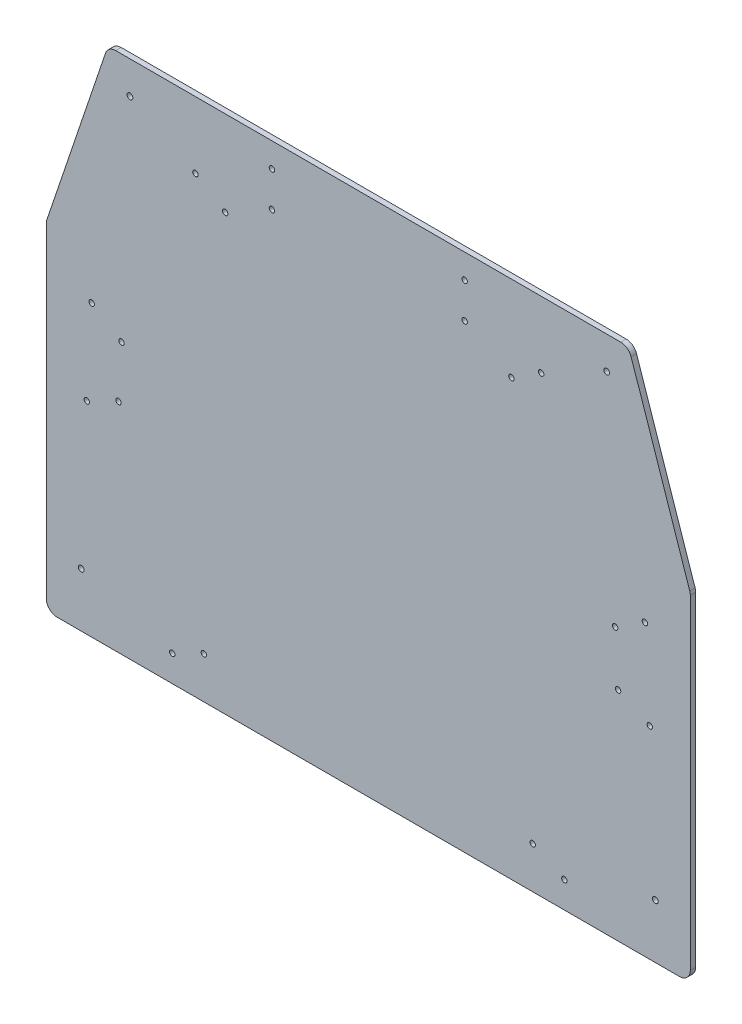
from build123d import *

# Parameters (mm, degrees)
SKETCH1_R                             = 5.3578125
BOSS_EXTRUDE1_DEPTH                   = 6.35
FILLET1_R                             = 6.35
CUT_EXTRUDE1_DEPTH                    = 1167.284548985
BOSS_EXTRUDE3_DEPTH                   = 6.35
SKETCH13_W                            = 3.175
SKETCH13_H                            = 76.2
F_1_4_0_25_DIAMETER_HOLE4_AT_2_COUNT  = 2
F_1_4_0_25_DIAMETER_HOLE4_AT_2_PITCH  = 459.678567638
F_1_4_0_25_DIAMETER_HOLE4_AT_3_COUNT  = 2
F_1_4_0_25_DIAMETER_HOLE4_AT_3_PITCH  = 596.539198556
F_1_4_0_25_DIAMETER_HOLE4_AT_4_COUNT  = 2
F_1_4_0_25_DIAMETER_HOLE4_AT_4_PITCH  = 568.707381741
F_1_4_0_25_DIAMETER_HOLE4_AT_5_COUNT  = 2
F_1_4_0_25_DIAMETER_HOLE4_AT_5_PITCH  = 422.93434027
F_1_4_0_25_DIAMETER_HOLE4_AT_6_COUNT  = 2
F_1_4_0_25_DIAMETER_HOLE4_AT_6_PITCH  = 592.904725038
F_1_4_0_25_DIAMETER_HOLE4_AT_7_COUNT  = 2
F_1_4_0_25_DIAMETER_HOLE4_AT_7_PITCH  = 634.11103449
F_1_4_0_25_DIAMETER_HOLE4_AT_8_COUNT  = 2
F_1_4_0_25_DIAMETER_HOLE4_AT_8_PITCH  = 622.278043561
F_1_4_0_25_DIAMETER_HOLE4_AT_9_COUNT  = 2
F_1_4_0_25_DIAMETER_HOLE4_AT_9_PITCH  = 661.65758107
F_1_4_0_25_DIAMETER_HOLE4_AT_10_COUNT = 2
F_1_4_0_25_DIAMETER_HOLE4_AT_10_PITCH = 648.217378276
F_1_4_0_25_DIAMETER_HOLE4_AT_11_COUNT = 2
F_1_4_0_25_DIAMETER_HOLE4_AT_11_PITCH = 613.575602616
F_1_4_0_25_DIAMETER_HOLE4_AT_12_COUNT = 2
F_1_4_0_25_DIAMETER_HOLE4_AT_12_PITCH = 522.113747952
F_1_4_0_25_DIAMETER_HOLE4_AT_13_COUNT = 2
F_1_4_0_25_DIAMETER_HOLE4_AT_13_PITCH = 562.417563003
F_1_4_0_25_DIAMETER_HOLE4_AT_14_COUNT = 2
F_1_4_0_25_DIAMETER_HOLE4_AT_14_PITCH = 501.478009771
F_1_4_0_25_DIAMETER_HOLE4_AT_15_COUNT = 2
F_1_4_0_25_DIAMETER_HOLE4_AT_15_PITCH = 482.69646419
F_1_4_0_25_DIAMETER_HOLE4_AT_16_COUNT = 2
F_1_4_0_25_DIAMETER_HOLE4_AT_16_PITCH = 322.499599747
F_1_4_0_25_DIAMETER_HOLE4_AT_17_COUNT = 2
F_1_4_0_25_DIAMETER_HOLE4_AT_17_PITCH = 292.440889916
F_1_4_0_25_DIAMETER_HOLE4_AT_18_COUNT = 2
F_1_4_0_25_DIAMETER_HOLE4_AT_18_PITCH = 41.275
F_1_4_0_25_DIAMETER_HOLE4_AT_19_COUNT = 2
F_1_4_0_25_DIAMETER_HOLE4_AT_19_PITCH = 232.85825455
F_1_4_0_25_DIAMETER_HOLE4_AT_20_COUNT = 2
F_1_4_0_25_DIAMETER_HOLE4_AT_20_PITCH = 229.170986574
SKETCH15_W                            = 754.968667661
SKETCH15_H                            = 28.575
CUT_EXTRUDE3_DEPTH                    = 1079.081505166
F_17_64_0_26563_DIAMETER_HOLE1_D      = 6.747002
CUT_EXTRUDE4_DEPTH                    = 1056.085396105
FILLET2_R                             = 12.7


with BuildPart() as part:
    # Sketch1 → Boss-Extrude1 (new body)
    with BuildSketch(Plane.XY):
        Polygon((382.546632935, 292.971606529), (128.546632935, 292.971606529), (-265.153367065, -872.634633965), (776.246632935, -872.634633965), align=None)
        with BuildLine():
            ThreePointArc((-156.175349405, -744.456069305), (-172.271579978, -752.424215975), (-180.239726648, -736.327985402))
            Line((-180.239726648, -736.327985402), (-172.111642745, -712.26360816))
            ThreePointArc((-172.111642745, -712.26360816), (-156.015412172, -704.29546149), (-148.047265502, -720.391692063))
            Line((-148.047265502, -720.391692063), (-156.175349405, -744.456069305))
        make_face(mode=Mode.SUBTRACT)
        with Locations((-82.126785136, -834.534633965)):
            Circle(SKETCH1_R, mode=Mode.SUBTRACT)
        with BuildLine():
            ThreePointArc((-94.231734473, -816.754633965), (-106.931734473, -804.054633965), (-94.231734473, -791.354633965))
            Line((-94.231734473, -791.354633965), (-68.831734473, -791.354633965))
            ThreePointArc((-68.831734473, -791.354633965), (-56.131734473, -804.054633965), (-68.831734473, -816.754633965))
            Line((-68.831734473, -816.754633965), (-94.231734473, -816.754633965))
        make_face(mode=Mode.SUBTRACT)
        with Locations((-193.570796303, -720.234633965)):
            Circle(SKETCH1_R, mode=Mode.SUBTRACT)
        with Locations((-82.126785136, -390.288393471)):
            Circle(SKETCH1_R, mode=Mode.SUBTRACT)
        with BuildLine():
            ThreePointArc((-44.707720392, -414.439904738), (-60.803950965, -422.408051408), (-68.772097635, -406.311820835))
            Line((-68.772097635, -406.311820835), (-60.644013732, -382.247443592))
            ThreePointArc((-60.644013732, -382.247443592), (-44.54778316, -374.279296923), (-36.57963649, -390.375527495))
            Line((-36.57963649, -390.375527495), (-44.707720392, -414.439904738))
        make_face(mode=Mode.SUBTRACT)
        with Locations((593.220051006, -834.534633965)):
            Circle(SKETCH1_R, mode=Mode.SUBTRACT)
        with BuildLine():
            ThreePointArc((580.520051006, -816.754633965), (567.820051006, -804.054633965), (580.520051006, -791.354633965))
            Line((580.520051006, -791.354633965), (605.920051006, -791.354633965))
            ThreePointArc((605.920051006, -791.354633965), (618.620051006, -804.054633965), (605.920051006, -816.754633965))
            Line((605.920051006, -816.754633965), (580.520051006, -816.754633965))
        make_face(mode=Mode.SUBTRACT)
        with BuildLine():
            ThreePointArc((691.332992518, -736.327985402), (683.364845848, -752.424215975), (667.268615276, -744.456069305))
            Line((667.268615276, -744.456069305), (659.140531373, -720.391692063))
            ThreePointArc((659.140531373, -720.391692063), (667.108678043, -704.29546149), (683.204908616, -712.26360816))
            Line((683.204908616, -712.26360816), (691.332992518, -736.327985402))
        make_face(mode=Mode.SUBTRACT)
        with Locations((704.664062174, -720.234633965)):
            Circle(SKETCH1_R, mode=Mode.SUBTRACT)
        with BuildLine():
            ThreePointArc((579.865363506, -406.311820835), (571.897216836, -422.408051408), (555.800986263, -414.439904738))
            Line((555.800986263, -414.439904738), (547.67290236, -390.375527495))
            ThreePointArc((547.67290236, -390.375527495), (555.64104903, -374.279296923), (571.737279603, -382.247443592))
            Line((571.737279603, -382.247443592), (579.865363506, -406.311820835))
        make_face(mode=Mode.SUBTRACT)
        with Locations((593.220051006, -390.288393471)):
            Circle(SKETCH1_R, mode=Mode.SUBTRACT)
        with Locations((19.96580657, -88.028393471)):
            Circle(SKETCH1_R, mode=Mode.SUBTRACT)
        with BuildLine():
            ThreePointArc((57.266750557, -112.529618456), (41.170519984, -120.497765125), (33.202373314, -104.401534553))
            Line((33.202373314, -104.401534553), (41.330457217, -80.33715731))
            ThreePointArc((41.330457217, -80.33715731), (57.426687789, -72.36901064), (65.394834459, -88.465241213))
            Line((65.394834459, -88.465241213), (57.266750557, -112.529618456))
        make_face(mode=Mode.SUBTRACT)
        with Locations((114.659199441, 192.325199783)):
            Circle(SKETCH1_R, mode=Mode.SUBTRACT)
        with BuildLine():
            ThreePointArc((152.013630654, 167.98233153), (135.917400082, 160.01418486), (127.949253412, 176.110415433))
            Line((127.949253412, 176.110415433), (136.077337315, 200.174792676))
            ThreePointArc((136.077337315, 200.174792676), (152.173567887, 208.142939345), (160.141714557, 192.046708773))
            Line((160.141714557, 192.046708773), (152.013630654, 167.98233153))
        make_face(mode=Mode.SUBTRACT)
        with BuildLine():
            ThreePointArc((192.113515822, 228.547158802), (179.413515822, 241.247158802), (192.113515822, 253.947158802))
            Line((192.113515822, 253.947158802), (217.513515822, 253.947158802))
            ThreePointArc((217.513515822, 253.947158802), (230.213515822, 241.247158802), (217.513515822, 228.547158802))
            Line((217.513515822, 228.547158802), (192.113515822, 228.547158802))
        make_face(mode=Mode.SUBTRACT)
        with Locations((204.746632935, 271.727158802)):
            Circle(SKETCH1_R, mode=Mode.SUBTRACT)
        with BuildLine():
            ThreePointArc((477.890892557, -104.401534553), (469.922745887, -120.497765125), (453.826515314, -112.529618456))
            Line((453.826515314, -112.529618456), (445.698431411, -88.465241213))
            ThreePointArc((445.698431411, -88.465241213), (453.666578081, -72.36901064), (469.762808654, -80.33715731))
            Line((469.762808654, -80.33715731), (477.890892557, -104.401534553))
        make_face(mode=Mode.SUBTRACT)
        with Locations((491.127459301, -88.028393471)):
            Circle(SKETCH1_R, mode=Mode.SUBTRACT)
        with BuildLine():
            ThreePointArc((383.129387686, 176.153714205), (375.161241016, 160.057483633), (359.065010443, 168.025630302))
            Line((359.065010443, 168.025630302), (350.936926541, 192.090007545))
            ThreePointArc((350.936926541, 192.090007545), (358.905073211, 208.186238118), (375.001303783, 200.218091448))
            Line((375.001303783, 200.218091448), (383.129387686, 176.153714205))
        make_face(mode=Mode.SUBTRACT)
        with BuildLine():
            ThreePointArc((293.646632935, 228.547158802), (280.946632935, 241.247158802), (293.646632935, 253.947158802))
            Line((293.646632935, 253.947158802), (319.046632935, 253.947158802))
            ThreePointArc((319.046632935, 253.947158802), (331.746632935, 241.247158802), (319.046632935, 228.547158802))
            Line((319.046632935, 228.547158802), (293.646632935, 228.547158802))
        make_face(mode=Mode.SUBTRACT)
        with Locations((306.346632935, 271.727158802)):
            Circle(SKETCH1_R, mode=Mode.SUBTRACT)
        with Locations((396.756156044, 191.371606529)):
            Circle(SKETCH1_R, mode=Mode.SUBTRACT)
    extrude(amount=BOSS_EXTRUDE1_DEPTH)

    # Fillet1
    fillet1_edges = [part.edges().sort_by_distance(p)[0] for p in [
        (-265.153367065, -872.634633965, 3.175),
        (776.246632935, -872.634633965, 3.175),
        (382.546632935, 292.971606529, 3.175),
        (128.546632935, 292.971606529, 3.175),
    ]]
    fillet(fillet1_edges, radius=FILLET1_R)

    # Sketch2 → Cut-Extrude1 (cut, through all)
    with BuildSketch(Plane.XY.offset(6.35)):
        with BuildLine():
            Line((91.647166248, -808.257330621), (67.972798838, -842.067831249))
            ThreePointArc((67.972798838, -842.067831249), (255.546632935, -247.159633965), (443.120467033, -842.067831249))
            Line((443.120467033, -842.067831249), (419.446099623, -808.257330621))
            ThreePointArc((419.446099623, -808.257330621), (255.546632935, -288.434633965), (91.647166248, -808.257330621))
        make_face()
    extrude(amount=-CUT_EXTRUDE1_DEPTH, mode=Mode.SUBTRACT)


with BuildPart() as body_2:
    # Sketch7 → Boss-Extrude3 (new body)
    with BuildSketch(Plane(origin=(0, 0, -63.5), x_dir=(-1, 0, 0), z_dir=(0, 0, -1))):
        Polygon((121.937700895, -872.634633965), (-633.030966766, -872.634633965), (-633.030966766, -448.623777416), (-547.825183006, -196.359633965), (36.731917136, -196.359633965), (121.937700895, -448.623777416), align=None)
    extrude(amount=BOSS_EXTRUDE3_DEPTH)

    # Sketch13 → 1/4 (0.25) Diameter Hole4 (revolve, cut)
    with BuildSketch(Plane(origin=(25.707349116, -813.178486157, -69.85), x_dir=(0, 1, 0), z_dir=(1, 0, 0))):
        with Locations((1.5875, 38.1)):
            Rectangle(SKETCH13_W, SKETCH13_H)
    f_1_4_0_25_diameter_hole4 = revolve(axis=Axis((25.707349116, -813.178486157, -76.2), (0, 0, 1)), mode=Mode.SUBTRACT)

    # 1/4 (0.25) Diameter Hole4 at 2: 1/4 (0.25) Diameter Hole4 ×2
    with Locations(*[(i * F_1_4_0_25_DIAMETER_HOLE4_AT_2_PITCH, 0, 0) for i in range(1, F_1_4_0_25_DIAMETER_HOLE4_AT_2_COUNT)]):
        add(f_1_4_0_25_diameter_hole4, mode=Mode.SUBTRACT)

    # 1/4 (0.25) Diameter Hole4 at 3: 1/4 (0.25) Diameter Hole4 ×2
    with Locations(*[Vector(0.9383907690341254, 0.345575989605098, 0) * (i * F_1_4_0_25_DIAMETER_HOLE4_AT_3_PITCH) for i in range(1, F_1_4_0_25_DIAMETER_HOLE4_AT_3_COUNT)]):
        add(f_1_4_0_25_diameter_hole4, mode=Mode.SUBTRACT)

    # 1/4 (0.25) Diameter Hole4 at 4: 1/4 (0.25) Diameter Hole4 ×2
    with Locations(*[Vector(0.9190282606116896, 0.39419164907066767, 0) * (i * F_1_4_0_25_DIAMETER_HOLE4_AT_4_PITCH) for i in range(1, F_1_4_0_25_DIAMETER_HOLE4_AT_4_COUNT)]):
        add(f_1_4_0_25_diameter_hole4, mode=Mode.SUBTRACT)

    # 1/4 (0.25) Diameter Hole4 at 5: 1/4 (0.25) Diameter Hole4 ×2
    with Locations(*[Vector(0.9990908894172673, 0.04263091229863252, 0) * (i * F_1_4_0_25_DIAMETER_HOLE4_AT_5_PITCH) for i in range(1, F_1_4_0_25_DIAMETER_HOLE4_AT_5_COUNT)]):
        add(f_1_4_0_25_diameter_hole4, mode=Mode.SUBTRACT)

    # 1/4 (0.25) Diameter Hole4 at 6: 1/4 (0.25) Diameter Hole4 ×2
    with Locations(*[Vector(0.8756676563773524, 0.4829142321102114, 0) * (i * F_1_4_0_25_DIAMETER_HOLE4_AT_6_PITCH) for i in range(1, F_1_4_0_25_DIAMETER_HOLE4_AT_6_COUNT)]):
        add(f_1_4_0_25_diameter_hole4, mode=Mode.SUBTRACT)

    # 1/4 (0.25) Diameter Hole4 at 7: 1/4 (0.25) Diameter Hole4 ×2
    with Locations(*[Vector(0.8737864077669905, 0.48630989461624, 0) * (i * F_1_4_0_25_DIAMETER_HOLE4_AT_7_PITCH) for i in range(1, F_1_4_0_25_DIAMETER_HOLE4_AT_7_COUNT)]):
        add(f_1_4_0_25_diameter_hole4, mode=Mode.SUBTRACT)

    # 1/4 (0.25) Diameter Hole4 at 8: 1/4 (0.25) Diameter Hole4 ×2
    with Locations(*[Vector(0.638946306539278, 0.7692513356243298, 0) * (i * F_1_4_0_25_DIAMETER_HOLE4_AT_8_PITCH) for i in range(1, F_1_4_0_25_DIAMETER_HOLE4_AT_8_COUNT)]):
        add(f_1_4_0_25_diameter_hole4, mode=Mode.SUBTRACT)

    # 1/4 (0.25) Diameter Hole4 at 9: 1/4 (0.25) Diameter Hole4 ×2
    with Locations(*[Vector(0.653649836215198, 0.7567971271191803, 0) * (i * F_1_4_0_25_DIAMETER_HOLE4_AT_9_PITCH) for i in range(1, F_1_4_0_25_DIAMETER_HOLE4_AT_9_COUNT)]):
        add(f_1_4_0_25_diameter_hole4, mode=Mode.SUBTRACT)

    # 1/4 (0.25) Diameter Hole4 at 10: 1/4 (0.25) Diameter Hole4 ×2
    with Locations(*[Vector(0.528870204123914, 0.8487027201499532, 0) * (i * F_1_4_0_25_DIAMETER_HOLE4_AT_10_PITCH) for i in range(1, F_1_4_0_25_DIAMETER_HOLE4_AT_10_COUNT)]):
        add(f_1_4_0_25_diameter_hole4, mode=Mode.SUBTRACT)

    # 1/4 (0.25) Diameter Hole4 at 11: 1/4 (0.25) Diameter Hole4 ×2
    with Locations(*[Vector(0.5587296100168245, 0.8293498796590297, 0) * (i * F_1_4_0_25_DIAMETER_HOLE4_AT_11_PITCH) for i in range(1, F_1_4_0_25_DIAMETER_HOLE4_AT_11_COUNT)]):
        add(f_1_4_0_25_diameter_hole4, mode=Mode.SUBTRACT)

    # 1/4 (0.25) Diameter Hole4 at 12: 1/4 (0.25) Diameter Hole4 ×2
    with Locations(*[Vector(0.22381274373799284, 0.9746321643268663, 0) * (i * F_1_4_0_25_DIAMETER_HOLE4_AT_12_PITCH) for i in range(1, F_1_4_0_25_DIAMETER_HOLE4_AT_12_COUNT)]):
        add(f_1_4_0_25_diameter_hole4, mode=Mode.SUBTRACT)

    # 1/4 (0.25) Diameter Hole4 at 13: 1/4 (0.25) Diameter Hole4 ×2
    with Locations(*[Vector(0.20777393552325948, 0.9781768713873665, 0) * (i * F_1_4_0_25_DIAMETER_HOLE4_AT_13_PITCH) for i in range(1, F_1_4_0_25_DIAMETER_HOLE4_AT_13_COUNT)]):
        add(f_1_4_0_25_diameter_hole4, mode=Mode.SUBTRACT)

    # 1/4 (0.25) Diameter Hole4 at 14: 1/4 (0.25) Diameter Hole4 ×2
    with Locations(*[Vector(0.05421214412483132, 0.9985294404419874, 0) * (i * F_1_4_0_25_DIAMETER_HOLE4_AT_14_PITCH) for i in range(1, F_1_4_0_25_DIAMETER_HOLE4_AT_14_COUNT)]):
        add(f_1_4_0_25_diameter_hole4, mode=Mode.SUBTRACT)

    # 1/4 (0.25) Diameter Hole4 at 15: 1/4 (0.25) Diameter Hole4 ×2
    with Locations(*[Vector(0.12860320029191077, 0.9916961313198105, 0) * (i * F_1_4_0_25_DIAMETER_HOLE4_AT_15_PITCH) for i in range(1, F_1_4_0_25_DIAMETER_HOLE4_AT_15_COUNT)]):
        add(f_1_4_0_25_diameter_hole4, mode=Mode.SUBTRACT)

    # 1/4 (0.25) Diameter Hole4 at 16: 1/4 (0.25) Diameter Hole4 ×2
    with Locations(*[Vector(-0.29271055030361265, 0.956201094823132, 0) * (i * F_1_4_0_25_DIAMETER_HOLE4_AT_16_PITCH) for i in range(1, F_1_4_0_25_DIAMETER_HOLE4_AT_16_COUNT)]):
        add(f_1_4_0_25_diameter_hole4, mode=Mode.SUBTRACT)

    # 1/4 (0.25) Diameter Hole4 at 17: 1/4 (0.25) Diameter Hole4 ×2
    with Locations(*[Vector(-0.20349043325815705, 0.9790769344502033, 0) * (i * F_1_4_0_25_DIAMETER_HOLE4_AT_17_PITCH) for i in range(1, F_1_4_0_25_DIAMETER_HOLE4_AT_17_COUNT)]):
        add(f_1_4_0_25_diameter_hole4, mode=Mode.SUBTRACT)

    # 1/4 (0.25) Diameter Hole4 at 18: 1/4 (0.25) Diameter Hole4 ×2
    with Locations(*[Vector(0.8995450382318291, 0.4368280258780305, 0) * (i * F_1_4_0_25_DIAMETER_HOLE4_AT_18_PITCH) for i in range(1, F_1_4_0_25_DIAMETER_HOLE4_AT_18_COUNT)]):
        add(f_1_4_0_25_diameter_hole4, mode=Mode.SUBTRACT)

    # 1/4 (0.25) Diameter Hole4 at 19: 1/4 (0.25) Diameter Hole4 ×2
    with Locations(*[Vector(-0.27046319797490564, 0.9627303145435835, 0) * (i * F_1_4_0_25_DIAMETER_HOLE4_AT_19_PITCH) for i in range(1, F_1_4_0_25_DIAMETER_HOLE4_AT_19_COUNT)]):
        add(f_1_4_0_25_diameter_hole4, mode=Mode.SUBTRACT)

    # 1/4 (0.25) Diameter Hole4 at 20: 1/4 (0.25) Diameter Hole4 ×2
    with Locations(*[Vector(-0.43682802587803055, 0.899545038231829, 0) * (i * F_1_4_0_25_DIAMETER_HOLE4_AT_20_PITCH) for i in range(1, F_1_4_0_25_DIAMETER_HOLE4_AT_20_COUNT)]):
        add(f_1_4_0_25_diameter_hole4, mode=Mode.SUBTRACT)

    # Sketch15 → Cut-Extrude3 (cut, through all)
    with BuildSketch(Plane.XY.offset(-63.5)):
        with Locations((255.546632935, -858.347133965)):
            Rectangle(SKETCH15_W, SKETCH15_H)
    extrude(amount=-CUT_EXTRUDE3_DEPTH, mode=Mode.SUBTRACT)

    # 17/64 (0.26563) Diameter Hole1 (through all)
    with Locations(Plane.XY.offset(-63.5)):
        with Locations((-23.853367065, -272.559633965), (534.946632935, -272.559633965), (592.096632935, -780.559633965), (-81.003367065, -780.559633965)):
            Hole(F_17_64_0_26563_DIAMETER_HOLE1_D / 2)

    # Sketch19 → Cut-Extrude4 (cut, through all)
    with BuildSketch(Plane.XY.offset(-63.5)):
        Polygon((547.825183006, -196.359633965), (560.693997087, -234.459633965), (-49.600731216, -234.459633965), (-36.731917136, -196.359633965), align=None)
    extrude(amount=-CUT_EXTRUDE4_DEPTH, mode=Mode.SUBTRACT)

    # Fillet2
    fillet2_edges = [body_2.edges().sort_by_distance(p)[0] for p in [
        (633.030966766, -448.623777416, -66.675),
        (-121.937700895, -448.623777416, -66.675),
        (-121.937700895, -844.059633965, -66.675),
        (633.030966766, -844.059633965, -66.675),
        (560.693997087, -234.459633965, -66.675),
        (-49.600731216, -234.459633965, -66.675),
    ]]
    fillet(fillet2_edges, radius=FILLET2_R)


solid = body_2.part
